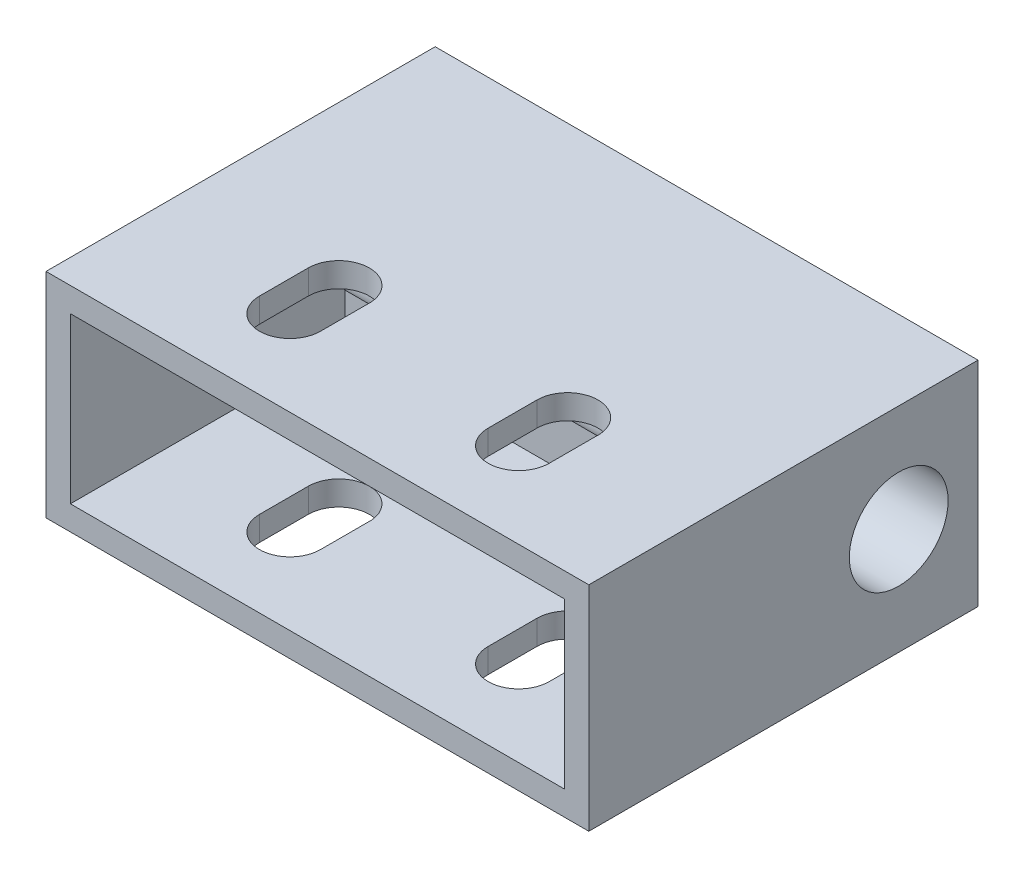
from build123d import *

# Parameters (mm, degrees)
SKETCH1_W           = 22.606
SKETCH1_H           = 16.208375
BOSS_EXTRUDE1_DEPTH = 8.89
SKETCH2_W           = 20.574
SKETCH2_H           = 6.858
CUT_EXTRUDE1_DEPTH  = 11.43
SKETCH5_R           = 2.0574
CUT_EXTRUDE3_DEPTH  = 54.026480056
CUT_EXTRUDE4_DEPTH  = 22.784480056


with BuildPart() as part:
    # Sketch1 → Boss-Extrude1 (new body)
    with BuildSketch(Plane(origin=(0, 0, 0), x_dir=(1, 0, 0), z_dir=(0, 1, 0))):
        with Locations((11.303, 8.1041875)):
            Rectangle(SKETCH1_W, SKETCH1_H)
    extrude(amount=BOSS_EXTRUDE1_DEPTH)

    # Sketch2 → Cut-Extrude1 (cut)
    with BuildSketch(Plane.XY):
        with Locations((11.303, 4.445)):
            Rectangle(SKETCH2_W, SKETCH2_H)
    extrude(amount=-CUT_EXTRUDE1_DEPTH, mode=Mode.SUBTRACT)

    # Sketch5 → Cut-Extrude3 (cut)
    with BuildSketch(Plane(origin=(22.606, 0, 0), x_dir=(0, 0, -1), z_dir=(1, 0, 0))):
        with Locations((12.906375, 4.445)):
            Circle(SKETCH5_R)
    extrude(amount=-CUT_EXTRUDE3_DEPTH, mode=Mode.SUBTRACT)

    # Sketch3 → Cut-Extrude4 (cut)
    with BuildSketch(Plane(origin=(0, 8.89, 0), x_dir=(1, 0, 0), z_dir=(0, 1, 0))):
        with BuildLine():
            Line((5.334, 5.587999039), (5.334, 3.556))
            ThreePointArc((5.334, 3.556), (6.604, 2.286), (7.874, 3.556))
            Line((7.874, 3.556), (7.874, 5.487791517))
            ThreePointArc((7.874, 5.487791517), (6.65611942, 6.858986996), (5.334, 5.587999039))
        make_face()
        with BuildLine():
            Line((14.859, 5.587999039), (14.859, 3.556))
            ThreePointArc((14.859, 3.556), (16.129, 2.286), (17.399, 3.556))
            Line((17.399, 3.556), (17.399, 5.487791517))
            ThreePointArc((17.399, 5.487791517), (16.18111942, 6.858986996), (14.859, 5.587999039))
        make_face()
    extrude(amount=-CUT_EXTRUDE4_DEPTH, mode=Mode.SUBTRACT)


solid = part.part
